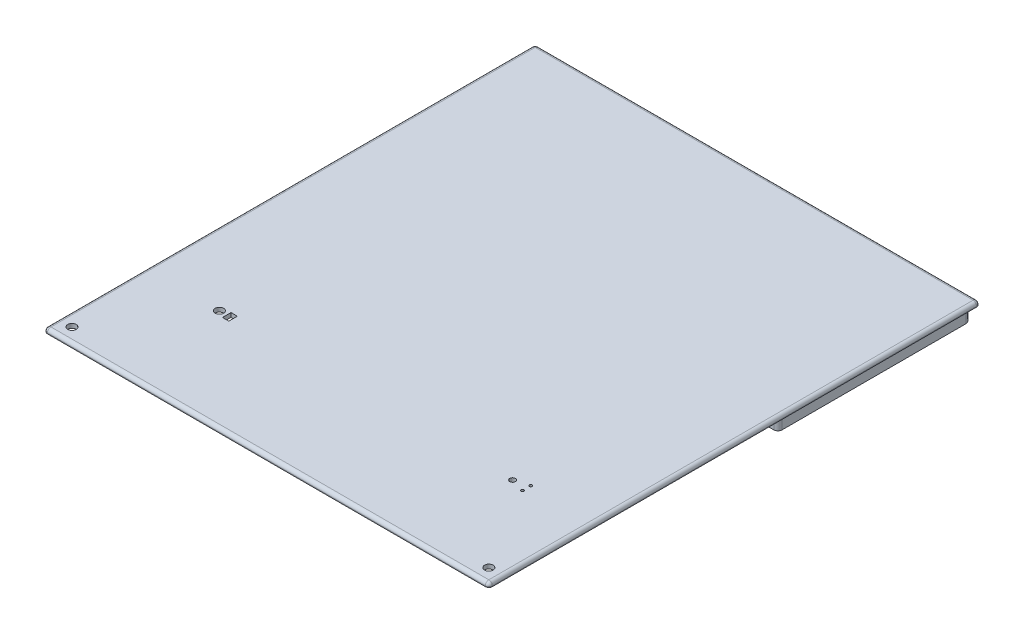
from build123d import *

# Parameters (mm, degrees)
BOSS_EXTRUDE1_DEPTH      = 1.25
SKETCH1_W                = 156
SKETCH1_H                = 69.5
BOSS_EXTRUDE2_DEPTH      = 105
SKETCH4_R                = 2.5000000000000027
BOSS_EXTRUDE3_DEPTH      = 8
FILLET2_R                = 2
SKETCH5_R                = 1.5499999999999998
SKETCH5_R_2              = 1.5500000000000012
CUT_EXTRUDE1_DEPTH       = 8
SKETCH6_R                = 8.25
CUT_EXTRUDE2_DEPTH       = 8
SKETCH8_R                = 3.750000000000007
SKETCH8_R_2              = 3.0000000000000084
SKETCH8_W                = 7.000000000000014
SKETCH8_H                = 14
CUT_EXTRUDE3_DEPTH       = 8
FILLET3_R                = 1.25
FILLET4_R                = 1.25
SKETCH11_R               = 1.5499999999999932
CUT_EXTRUDE4_DEPTH       = 8
BOSS_EXTRUDE5_REACH      = 209.004
FILLET5_R                = 1.25
SKETCH14_R               = 1.5249999999999995
CUT_EXTRUDE5_DEPTH       = 8
BOSS_EXTRUDE6_DEPTH      = 5
CUT_EXTRUDE10_DEPTH      = 176.50000000000017
CUT_EXTRUDE10_DEPTH_BACK = 9
SKETCH19_R               = 1.5249999999999995
BOSS_EXTRUDE7_DEPTH      = 1.5
SKETCH17_W               = 214.39373035957487
SKETCH17_H               = 311.75060194691184
CUT_EXTRUDE6_DEPTH       = 142.50000000000003
SKETCH18_W               = 843.8612520819788
SKETCH18_H               = 210.19069540658822
CUT_EXTRUDE7_DEPTH       = 211.50000000000009
FILLET6_R                = 1.25
SKETCH21_R               = 1.5249999999999995
CUT_EXTRUDE11_DEPTH      = 46.50000000000004
SKETCH22_R               = 1.5249999999999952
SKETCH22_R_2             = 0.49999999999999917
SKETCH22_R_3             = 0.9999999999999983
CUT_EXTRUDE12_DEPTH      = 46.50000000000004
SKETCH23_W               = 224.34927592813784
SKETCH23_H               = 20
CUT_EXTRUDE13_DEPTH      = 108.00000000000004
SKETCH24_W               = 223.8278832276348
SKETCH24_H               = 83.20006380200533
CUT_EXTRUDE14_DEPTH      = 108.00000000000004
BOSS_EXTRUDE8_DEPTH      = 79.12
FILLET7_R                = 1.25
SKETCH27_R               = 1.5249999999999904
SKETCH27_R_2             = 0.9999999999999983
SKETCH27_R_3             = 0.4999999999999892
SKETCH27_R_4             = 0.5000000000000013
SKETCH27_W               = 2.251539255366019
SKETCH27_H               = 3.049999999999997
CUT_EXTRUDE16_DEPTH      = 79.12
SKETCH28_R               = 1.5249999999999995
CUT_EXTRUDE17_DEPTH      = 79.12


with BuildPart() as part:
    # Sketch2 → Boss-Extrude1 (new body)
    with BuildSketch(Plane(origin=(0, 0, 0), x_dir=(1, 0, 0), z_dir=(0, 1, 0))):
        Polygon((-79.25000000000004, 35.99999999999998), (79.24999999999996, 35.99999999999999), (79.24999999999999, -159.00000000000003), (-79.25000000000001, -159.00000000000003), align=None)
    extrude(amount=-BOSS_EXTRUDE1_DEPTH)

    # Sketch1 → Boss-Extrude2 (add)
    with BuildSketch(Plane(origin=(0, 0, 0), x_dir=(1, 0, 0), z_dir=(0, 1, 0))):
        Polygon((79.24999999999999, -159.00000000000003), (-79.25000000000001, -159.00000000000003), (-79.25000000000004, -86.00000000000001), (-79.25000000000004, -36.00000000000002), (-79.25000000000004, 35.99999999999998), (79.24999999999996, 35.99999999999999), (79.24999999999996, -36.00000000000002), (79.24999999999996, -86.00000000000001), align=None)
        Polygon((-78.00000000000001, -157.75000000000006), (77.99999999999999, -157.75000000000006), (77.99999999999996, -86.00000000000001), (77.99999999999996, -36.00000000000002), (-78.00000000000004, -36.00000000000002), (-78.00000000000004, -86.00000000000001), (-78.00000000000004, -100.58859756900745), align=None, mode=Mode.SUBTRACT)
        Rectangle(SKETCH1_W, SKETCH1_H, mode=Mode.SUBTRACT)
    extrude(amount=BOSS_EXTRUDE2_DEPTH)

    # Sketch4 → Boss-Extrude3 (add)
    with BuildSketch(Plane(origin=(0, 0, 0), x_dir=(1, 0, 0), z_dir=(0, 1, 0))):
        with Locations(Location((-37.074999999999996, -117.75000000000004, 0), (0, 0, 90))):
            Circle(SKETCH4_R)
        with Locations(Location((37.074999999999996, -117.75000000000003, 0), (0, 0, 90))):
            Circle(SKETCH4_R)
    extrude(amount=BOSS_EXTRUDE3_DEPTH)

    # Fillet2
    fillet2_edges = [part.edges().sort_by_distance(p)[0] for p in [
        (77.99999999999996, 52.5, -34.749999999999986),
        (77.99999999999996, 52.5, 34.750000000000014),
        (-78.00000000000004, 0, 1.421e-14),
        (-78.00000000000004, 52.5, 34.750000000000014),
        (77.99999999999999, 52.5, 157.75000000000006),
        (-78.00000000000001, 52.5, 157.75000000000006),
        (-4.263e-14, 0, 36.00000000000002),
        (-78.00000000000004, 52.5, 36.00000000000002),
        (77.99999999999997, 0, 96.87500000000003),
        (77.99999999999996, 52.5, 36.00000000000002),
        (-4.263e-14, 0, -34.749999999999986),
        (-78.00000000000004, 52.5, -34.749999999999986),
        (-1.421e-14, 0, 157.75000000000006),
        (-78.00000000000003, 0, 96.87500000000004),
        (77.99999999999996, 0, 1.421e-14),
        (-4.263e-14, 0, 34.750000000000014),
        (-37.074999999999996, 0, 120.25000000000004),
        (37.074999999999996, 0, 120.25000000000003),
    ]]
    fillet(fillet2_edges, radius=FILLET2_R)

    # Sketch5 → Cut-Extrude1 (cut)
    with BuildSketch(Plane.XY.offset(36.00000000000002)):
        with BuildLine():
            ThreePointArc((-53.750000000000085, 99.54999999999998), (-54.84601551083924, 99.09601551083914), (-55.30000000000008, 97.99999999999999))
            Line((-55.30000000000008, 97.99999999999999), (-53.750000000000085, 97.99999999999999))
            Line((-53.750000000000085, 97.99999999999999), (-53.750000000000085, 99.54999999999998))
        make_face()
        with BuildLine():
            Line((-53.750000000000085, 97.99999999999999), (-55.30000000000008, 97.99999999999999))
            ThreePointArc((-55.30000000000008, 97.99999999999999), (-53.750000000000085, 96.44999999999999), (-52.20000000000009, 97.99999999999999))
            ThreePointArc((-52.20000000000009, 97.99999999999999), (-52.65398448916093, 99.09601551083914), (-53.750000000000085, 99.54999999999998))
            Line((-53.750000000000085, 99.54999999999998), (-53.750000000000085, 97.99999999999999))
        make_face()
        with Locations((53.750000000000206, 97.99999999999967)):
            Circle(SKETCH5_R)
        with Locations((-53.750000000000085, 7.999999999999743)):
            Circle(SKETCH5_R_2)
        with Locations((53.749999999999666, 7.9999999999994245)):
            Circle(SKETCH5_R_2)
    extrude(amount=-CUT_EXTRUDE1_DEPTH, mode=Mode.SUBTRACT)

    # Sketch6 → Cut-Extrude2 (cut)
    with BuildSketch(Plane(origin=(0, 0, 157.75000000000006), x_dir=(-1, 0, 0), z_dir=(0, 0, -1))):
        with Locations((0, 22)):
            Circle(SKETCH6_R)
    extrude(amount=-CUT_EXTRUDE2_DEPTH, mode=Mode.SUBTRACT)

    # Sketch8 → Cut-Extrude3 (cut)
    with BuildSketch(Plane.ZY.offset(79.25000000000004)):
        with Locations((131.5, 54.99999999999998)):
            Circle(SKETCH8_R)
        with Locations((101.50000000000001, 54.99999999999998)):
            Circle(SKETCH8_R_2)
        with Locations((116.50000000000003, 64.99999999999999)):
            Rectangle(SKETCH8_W, SKETCH8_H)
        with Locations((101.50000000000001, 64.99999999999997)):
            Circle(SKETCH8_R_2)
        with Locations((101.50000000000001, 74.99999999999997)):
            Circle(SKETCH8_R_2)
        with Locations((101.50000000000001, 84.99999999999997)):
            Circle(SKETCH8_R_2)
        with Locations((131.5, 74.99999999999999)):
            Circle(SKETCH8_R)
    extrude(amount=-CUT_EXTRUDE3_DEPTH, mode=Mode.SUBTRACT)

    # Fillet3
    fillet3_edges = [part.edges().sort_by_distance(p)[0] for p in [
        (79.24999999999997, -1.25, 61.50000000000002),
        (-4.263e-14, -1.25, -35.999999999999986),
        (-79.25000000000003, -1.25, 61.50000000000003),
        (-1.421e-14, -1.25, 159.00000000000003),
    ]]
    fillet(fillet3_edges, radius=FILLET3_R)

    # Fillet4
    # the kernel refuses this fillet: 1.25 mm, written as the material it takes off along each edge
    with BuildSketch(Plane(origin=(-78.00000000000004, 0, -34.74999999999997), x_dir=(-9e-17, 0, -1), z_dir=(-1, 0, 1.5e-16))) as fillet4_piece_1_section:
        Polygon((0, 0), (FILLET4_R, 0), (FILLET4_R, FILLET4_R), (0, FILLET4_R), align=None)
    fillet4_piece_1 = extrude(amount=FILLET4_R, mode=Mode.PRIVATE)
    fillet4_piece_1 = fillet4_piece_1 - Plane(origin=(-78.00000000000004, 0, -34.74999999999997), x_dir=(0, 0.7071067811865475, 0.7071067811865475), z_dir=(-1, 0, 1.5e-16)) * Sphere(FILLET4_R, mode=Mode.PRIVATE)
    add(fillet4_piece_1, mode=Mode.SUBTRACT)
    with BuildSketch(Plane(origin=(77.99999999999996, 0, -34.74999999999999), x_dir=(-9e-17, 0, -1), z_dir=(1, 0, -1.5e-16))) as fillet4_piece_2_section:
        Polygon((0, 0), (FILLET4_R, 0), (FILLET4_R, -FILLET4_R), (0, -FILLET4_R), align=None)
    fillet4_piece_2 = extrude(amount=FILLET4_R, mode=Mode.PRIVATE)
    fillet4_piece_2 = fillet4_piece_2 - Plane(origin=(77.99999999999996, 0, -34.74999999999999), x_dir=(0, 0.7071067811865475, 0.7071067811865475), z_dir=(1, 0, -1.5e-16)) * Sphere(FILLET4_R, mode=Mode.PRIVATE)
    add(fillet4_piece_2, mode=Mode.SUBTRACT)
    with BuildSketch(Plane(origin=(-78.00000000000001, 0, 157.75000000000003), x_dir=(-1, 0, 1.5e-16), z_dir=(0, 0, 1))) as fillet4_piece_3_section:
        Polygon((0, 0), (FILLET4_R, 0), (FILLET4_R, FILLET4_R), (0, FILLET4_R), align=None)
    fillet4_piece_3 = extrude(amount=FILLET4_R, mode=Mode.PRIVATE)
    fillet4_piece_3 = fillet4_piece_3 - Plane(origin=(-78.00000000000001, 0, 157.75000000000003), x_dir=(0.7071067811865475, 0.7071067811865475, 0), z_dir=(0, 0, 1)) * Sphere(FILLET4_R, mode=Mode.PRIVATE)
    add(fillet4_piece_3, mode=Mode.SUBTRACT)
    with BuildSketch(Plane(origin=(77.99999999999999, 0, 157.75000000000003), x_dir=(1, 0, -1.5e-16), z_dir=(0, 0, 1))) as fillet4_piece_4_section:
        Polygon((0, 0), (FILLET4_R, 0), (FILLET4_R, -FILLET4_R), (0, -FILLET4_R), align=None)
    fillet4_piece_4 = extrude(amount=FILLET4_R, mode=Mode.PRIVATE)
    fillet4_piece_4 = fillet4_piece_4 - Plane(origin=(77.99999999999999, 0, 157.75000000000003), x_dir=(-0.7071067811865475, 0.7071067811865475, 0), z_dir=(0, 0, 1)) * Sphere(FILLET4_R, mode=Mode.PRIVATE)
    add(fillet4_piece_4, mode=Mode.SUBTRACT)
    with BuildSketch(Plane(origin=(79.24999999999999, 108.12500000000007, 159.00000000000003), x_dir=(-1, 0, 0), z_dir=(0, -1, 0))) as fillet4_piece_5:
        with BuildLine():
            CenterArc((FILLET4_R, FILLET4_R), FILLET4_R, 179.9999999999987, 90.00000000000131)
            Line((0, FILLET4_R), (0, 0))
            Line((0, 0), (FILLET4_R, 0))
        make_face()
    extrude(amount=108.12500000000007, mode=Mode.SUBTRACT)
    with BuildSketch(Plane(origin=(-79.25000000000001, -2.2e-16, 159.00000000000003), x_dir=(1, 0, 0), z_dir=(0, 1, 0))) as fillet4_piece_6:
        with BuildLine():
            CenterArc((FILLET4_R, FILLET4_R), FILLET4_R, 180, 90)
            Line((0, FILLET4_R), (0, 0))
            Line((0, 0), (FILLET4_R, 0))
        make_face()
    extrude(amount=108.12499999999999, mode=Mode.SUBTRACT)
    with BuildSketch(Plane(origin=(79.24999999999996, 108.125, -35.99999999999999), x_dir=(0, 0, 1), z_dir=(0, -1, 0))) as fillet4_piece_7:
        with BuildLine():
            CenterArc((FILLET4_R, FILLET4_R), FILLET4_R, 180, 90)
            Line((0, FILLET4_R), (0, 0))
            Line((0, 0), (FILLET4_R, 0))
        make_face()
    extrude(amount=108.125, mode=Mode.SUBTRACT)
    with BuildSketch(Plane(origin=(-79.25000000000004, -2.2e-16, -35.99999999999998), x_dir=(0, 0, 1), z_dir=(0, 1, 0))) as fillet4_piece_8:
        with BuildLine():
            CenterArc((FILLET4_R, FILLET4_R), FILLET4_R, 180, 90)
            Line((-2.132e-14, FILLET4_R), (0, 0))
            Line((0, 0), (FILLET4_R, 0))
        make_face()
    extrude(amount=108.12499999999999, mode=Mode.SUBTRACT)

    # Sketch11 → Cut-Extrude4 (cut)
    with BuildSketch(Plane(origin=(79.24999999999996, 0, -1.128e-14), x_dir=(-1.4e-16, 0, -1), z_dir=(1, 0, -1.4e-16))):
        with BuildLine():
            ThreePointArc((-13.05000000000001, 102.49999999999999), (-12.596015510839159, 101.40398448916083), (-11.50000000000001, 100.94999999999999))
            Line((-11.50000000000001, 100.94999999999999), (-11.50000000000001, 102.49999999999999))
            Line((-11.500000000000014, 102.49999999999999), (-13.050000000000011, 102.49999999999999))
        make_face()
        with BuildLine():
            Line((-11.50000000000001, 102.49999999999999), (-11.50000000000001, 100.94999999999999))
            ThreePointArc((-11.50000000000001, 100.94999999999999), (-10.403984489160864, 101.40398448916083), (-9.950000000000012, 102.49999999999999))
            ThreePointArc((-9.950000000000012, 102.49999999999999), (-11.50000000000001, 104.04999999999998), (-13.05000000000001, 102.49999999999999))
            Line((-13.050000000000011, 102.49999999999999), (-11.500000000000014, 102.49999999999999))
        make_face()
        with BuildLine():
            ThreePointArc((-25.550000000000008, 90), (-25.096015510839155, 88.90398448916085), (-24.000000000000007, 88.45))
            Line((-24.000000000000007, 88.45000000000002), (-24.000000000000007, 90))
            Line((-24, 90), (-25.55000000000001, 90))
        make_face()
        with BuildLine():
            Line((-24.000000000000007, 90), (-24.000000000000007, 88.45000000000002))
            ThreePointArc((-24.000000000000007, 88.45), (-22.90398448916086, 88.90398448916085), (-22.450000000000006, 90))
            ThreePointArc((-22.450000000000006, 90), (-24.000000000000007, 91.55), (-25.550000000000008, 90))
            Line((-25.55000000000001, 90), (-24, 90))
        make_face()
        with BuildLine():
            ThreePointArc((-9.949999999999998, 2.4999999999999742), (-10.403984489160848, 3.5960155108391216), (-11.499999999999995, 4.049999999999974))
            Line((-11.499999999999996, 4.049999999999969), (-11.499999999999996, 2.4999999999999716))
            Line((-11.5, 2.4999999999999742), (-13.049999999999997, 2.4999999999999742))
            ThreePointArc((-13.049999999999995, 2.4999999999999742), (-11.499999999999996, 0.9499999999999749), (-9.949999999999998, 2.499999999999974))
        make_face()
        with BuildLine():
            Line((-11.499999999999996, 2.4999999999999716), (-11.499999999999996, 4.049999999999969))
            ThreePointArc((-11.499999999999995, 4.049999999999974), (-12.596015510839145, 3.596015510839123), (-13.049999999999995, 2.4999999999999742))
            Line((-13.049999999999997, 2.4999999999999742), (-11.5, 2.4999999999999742))
        make_face()
        with BuildLine():
            ThreePointArc((-111.5, 4.049999999999969), (-112.59601551083915, 1.40398448916083), (-109.95, 2.499999999999974))
            Line((-109.95, 2.4999999999999742), (-111.5, 2.4999999999999742))
            Line((-111.5, 2.4999999999999716), (-111.5, 4.049999999999969))
        make_face()
        with BuildLine():
            Line((-111.5, 2.4999999999999742), (-109.95, 2.4999999999999742))
            ThreePointArc((-109.95, 2.4999999999999742), (-110.40398448916086, 3.5960155108391185), (-111.5, 4.049999999999969))
            Line((-111.5, 4.049999999999969), (-111.5, 2.4999999999999716))
        make_face()
        with BuildLine():
            ThreePointArc((-97.45, 14.999999999999993), (-97.90398448916086, 16.096015510839138), (-99, 16.549999999999986))
            Line((-99, 16.549999999999986), (-99, 14.999999999999993))
            Line((-99, 14.999999999999993), (-97.45, 14.999999999999993))
        make_face()
        with BuildLine():
            Line((-99, 14.999999999999993), (-99, 16.549999999999986))
            ThreePointArc((-99, 16.549999999999986), (-100.09601551083915, 13.903984489160848), (-97.45, 14.999999999999993))
            Line((-97.45, 14.999999999999993), (-99, 14.999999999999993))
        make_face()
        with BuildLine():
            ThreePointArc((-22.450000000000006, 14.999999999999993), (-22.90398448916086, 16.09601551083914), (-24.000000000000007, 16.549999999999994))
            Line((-24.000000000000007, 16.549999999999994), (-24.000000000000007, 14.999999999999993))
            Line((-24, 14.999999999999993), (-25.55000000000001, 14.999999999999993))
            ThreePointArc((-25.550000000000008, 14.999999999999993), (-24.000000000000007, 13.449999999999992), (-22.450000000000006, 14.999999999999993))
        make_face()
        with BuildLine():
            Line((-24.000000000000007, 14.999999999999993), (-24.000000000000007, 16.549999999999994))
            ThreePointArc((-24.000000000000007, 16.549999999999994), (-25.096015510839155, 16.09601551083914), (-25.550000000000008, 14.999999999999993))
            Line((-25.55000000000001, 14.999999999999993), (-24, 14.999999999999993))
        make_face()
        with Locations((-111.50000000000001, 102.49999999999999)):
            Circle(SKETCH11_R)
        with Locations((-99, 90)):
            Circle(SKETCH11_R)
    extrude(amount=-CUT_EXTRUDE4_DEPTH, mode=Mode.SUBTRACT)

    # Boss-Extrude5: up to this face of the body (flat: up to its plane)
    boss_extrude5_end = Plane(part.part.faces().sort_by_distance((0, 0, 96.725539908))[0])
    # Sketch12 → Boss-Extrude5 (add, up to the picked face)
    with BuildSketch(Plane(origin=(0, 105, 0), x_dir=(1, 0, 0), z_dir=(0, 1, 0)), mode=Mode.PRIVATE) as boss_extrude5_sk1:
        with BuildLine():
            Line((73, -152.75000000000043), (72.99999999999997, -157.75000000000043))
            Line((72.99999999999997, -157.75000000000043), (75.99999999999996, -157.75000000000045))
            ThreePointArc((75.99999999999996, -157.75000000000006), (77.41421356237305, -157.16421356237316), (77.99999999999994, -155.75000000000006))
            Line((77.99999999999999, -155.75000000000006), (78, -152.75000000000045))
            Line((78, -152.75000000000045), (73, -152.75000000000043))
        make_face()
    boss_extrude5_tool1 = split(extrude(boss_extrude5_sk1.sketch, amount=-BOSS_EXTRUDE5_REACH, mode=Mode.PRIVATE), bisect_by=boss_extrude5_end, keep=Keep.BOTH, mode=Mode.PRIVATE)
    # Sketch12 → Boss-Extrude5 (add, up to the picked face)
    with BuildSketch(Plane(origin=(0, 105, 0), x_dir=(1, 0, 0), z_dir=(0, 1, 0)), mode=Mode.PRIVATE) as boss_extrude5_sk2:
        with BuildLine():
            ThreePointArc((-78.00000000000003, -155.75000000000006), (-77.41421356237313, -157.16421356237316), (-76.00000000000003, -157.75000000000006))
            Line((-76.00000000000003, -157.75000000000006), (-73.00000000000003, -157.75000000000006))
            Line((-73.00000000000003, -157.75000000000006), (-73.00000000000003, -152.75000000000006))
            Line((-73.00000000000003, -152.75000000000006), (-78.00000000000003, -152.75000000000006))
            Line((-78.00000000000003, -152.75000000000006), (-78.00000000000003, -155.75000000000006))
        make_face()
    boss_extrude5_tool2 = split(extrude(boss_extrude5_sk2.sketch, amount=-BOSS_EXTRUDE5_REACH, mode=Mode.PRIVATE), bisect_by=boss_extrude5_end, keep=Keep.BOTH, mode=Mode.PRIVATE)
    add(boss_extrude5_tool1.solids().sort_by(Axis((75.426992, 105, 155.176992), (0, -1, 0)))[0])
    add(boss_extrude5_tool2.solids().sort_by(Axis((-75.426992, 105, 155.176992), (0, -1, 0)))[0])

    # Fillet5
    fillet5_edges = [part.edges().sort_by_distance(p)[0] for p in [
        (77.41421356237306, 0.5857864376269042, 152.75000000000043),
        (72.99999999999999, 0.5857864376269046, 157.16421356237316),
        (72.99999999999997, 53.5, 157.75000000000043),
        (74.49999999999999, 0, 152.75000000000043),
        (73, 52.5, 152.75000000000043),
        (78, 53.5, 152.75000000000045),
        (73, 0, 154.25000000000023),
        (-77.41421356237313, 0.5857864376269042, 152.75000000000006),
        (-73.00000000000003, 0, 154.25000000000006),
        (-73.00000000000003, 52.5, 152.75000000000006),
        (-78.00000000000003, 53.5, 152.75000000000006),
        (-74.50000000000003, 0, 152.75000000000006),
        (-73.00000000000003, 0.5857864376269046, 157.16421356237316),
        (-73.00000000000003, 53.5, 157.75000000000006),
    ]]
    fillet(fillet5_edges, radius=FILLET5_R)

    # Sketch14 → Cut-Extrude5 (cut)
    with BuildSketch(Plane(origin=(0, 105, 0), x_dir=(1, 0, 0), z_dir=(0, 1, 0))):
        with Locations(Location((75.68305826175839, -155.43305826175865, 0), (0, 0, 270))):
            Circle(SKETCH14_R)
        with Locations(Location((-75.68305826175845, -155.43305826175828, 0), (0, 0, 270))):
            Circle(SKETCH14_R)
    extrude(amount=-CUT_EXTRUDE5_DEPTH, mode=Mode.SUBTRACT)

    # Sketch19 → Cut-Extrude10 (cut, two sides: drawn at the far end of the back side and taken through both)
    with BuildSketch(Plane(origin=(0, 105, 0), x_dir=(1, 0, 0), z_dir=(0, 1, 0)).offset(-CUT_EXTRUDE10_DEPTH_BACK)):
        with Locations(Location((75.68305826175839, -155.43305826175865, 0), (0, 0, 270))):
            Circle(SKETCH19_R)
        with Locations(Location((-75.68305826175845, -155.43305826175828, 0), (0, 0, 270))):
            Circle(SKETCH19_R)
    extrude(amount=CUT_EXTRUDE10_DEPTH + CUT_EXTRUDE10_DEPTH_BACK, mode=Mode.SUBTRACT)



with BuildPart() as body_2:
    # Sketch15 → Boss-Extrude6 (new body)
    with BuildSketch(Plane(origin=(0, 105, 0), x_dir=(1, 0, 0), z_dir=(0, 1, 0))):
        with BuildLine():
            Line((-77.50000000000004, 32.749999999999986), (-77.50000000000004, -32.750000000000014))
            ThreePointArc((-77.50000000000004, -32.750000000000014), (-77.06066017177986, -33.81066017177984), (-76.00000000000004, -34.250000000000014))
            Line((-76.00000000000004, -34.250000000000014), (75.99999999999996, -34.250000000000014))
            ThreePointArc((75.99999999999996, -34.250000000000014), (77.06066017177977, -33.81066017177984), (77.49999999999996, -32.750000000000014))
            Line((77.49999999999996, -32.750000000000014), (77.49999999999996, 32.749999999999986))
            ThreePointArc((77.49999999999996, 32.749999999999986), (77.06066017177977, 33.81066017177981), (75.99999999999996, 34.249999999999986))
            Line((75.99999999999996, 34.249999999999986), (-76.00000000000004, 34.249999999999986))
            ThreePointArc((-76.00000000000004, 34.249999999999986), (-77.06066017177986, 33.81066017177981), (-77.50000000000004, 32.749999999999986))
        make_face()
        with BuildLine():
            Line((75.99999999999996, 32.999999999999986), (-76.00000000000004, 32.999999999999986))
            ThreePointArc((-76.00000000000004, 32.999999999999986), (-76.17677669529668, 32.926776695296624), (-76.25000000000004, 32.749999999999986))
            Line((-76.25000000000004, 32.749999999999986), (-76.25000000000004, -32.750000000000014))
            ThreePointArc((-76.25000000000004, -32.750000000000014), (-76.17677669529668, -32.92677669529665), (-76.00000000000004, -33.000000000000014))
            Line((-76.00000000000004, -33.000000000000014), (75.99999999999996, -33.000000000000014))
            ThreePointArc((75.99999999999996, -33.000000000000014), (76.1767766952966, -32.92677669529665), (76.24999999999996, -32.750000000000014))
            Line((76.24999999999996, -32.750000000000014), (76.24999999999996, 32.749999999999986))
            ThreePointArc((76.24999999999996, 32.749999999999986), (76.1767766952966, 32.926776695296624), (75.99999999999996, 32.999999999999986))
        make_face(mode=Mode.SUBTRACT)
    extrude(amount=-BOSS_EXTRUDE6_DEPTH)


with BuildPart() as part_1:
    add(part.part)

    add(body_2.part)  # Boss-Extrude7 merges body 2
    # Sketch16 → Boss-Extrude7 (add)
    with BuildSketch(Plane(origin=(0, 105, 0), x_dir=(1, 0, 0), z_dir=(0, 1, 0))):
        with BuildLine():
            Line((-79.25000000000004, 34.74999999999998), (-79.25000000000004, -157.75000000000003))
            ThreePointArc((-79.25000000000004, -157.75000000000003), (-78.88388347648322, -158.63388347648322), (-78.00000000000001, -159.00000000000003))
            Line((-78.00000000000001, -159.00000000000003), (77.99999999999999, -159.00000000000003))
            ThreePointArc((77.99999999999999, -159.00000000000003), (78.88388347648316, -158.63388347648322), (79.24999999999999, -157.75000000000003))
            Line((79.24999999999999, -157.75000000000003), (79.24999999999991, 34.749999999999986))
            ThreePointArc((79.24999999999991, 34.749999999999986), (78.8838834764831, 35.63388347648314), (77.99999999999996, 35.99999999999997))
            Line((77.99999999999996, 35.99999999999997), (-78.00000000000004, 35.99999999999998))
            ThreePointArc((-78.00000000000004, 35.99999999999998), (-78.88388347648322, 35.63388347648316), (-79.25000000000004, 34.74999999999998))
        make_face()
    extrude(amount=BOSS_EXTRUDE7_DEPTH)

    # Sketch17 → Cut-Extrude6 (cut)
    with BuildSketch(Plane.XZ.offset(-105)):
        with Locations((-9.695908791144348, 54.3605461890202)):
            Rectangle(SKETCH17_W, SKETCH17_H)
        with BuildLine():
            Line((77.99999999999996, -32.749999999999986), (77.99999999999996, 32.750000000000014))
            ThreePointArc((77.99999999999996, 32.750000000000014), (77.41421356237305, 34.16421356237311), (75.99999999999996, 34.750000000000014))
            Line((75.99999999999996, 34.750000000000014), (-76.00000000000004, 34.750000000000014))
            ThreePointArc((-76.00000000000004, 34.750000000000014), (-77.41421356237313, 34.16421356237311), (-78.00000000000004, 32.750000000000014))
            Line((-78.00000000000004, 32.750000000000014), (-78.00000000000004, -32.749999999999986))
            ThreePointArc((-78.00000000000004, -32.749999999999986), (-77.41421356237313, -34.16421356237308), (-76.00000000000004, -34.749999999999986))
            Line((-76.00000000000004, -34.749999999999986), (75.99999999999996, -34.749999999999986))
            ThreePointArc((75.99999999999996, -34.749999999999986), (77.41421356237305, -34.16421356237308), (77.99999999999996, -32.749999999999986))
        make_face(mode=Mode.SUBTRACT)
    extrude(amount=CUT_EXTRUDE6_DEPTH, mode=Mode.SUBTRACT)


with BuildPart() as cut_extrude6_piece_1:
    # of the separate pieces the step leaves, piece 1, a body of its own (cut_extrude6_pieces)
    add(part_1.part.solids().sort_by_distance((-76, 105, -34.25))[0])

    # Fillet6
    fillet6_edges = [cut_extrude6_piece_1.edges().sort_by_distance(p)[0] for p in [
        (-78.88388347648322, 106.5, -35.633883476483156),
        (-79.25000000000004, 106.5, 61.50000000000002),
        (-78.88388347648322, 106.5, 158.63388347648322),
        (-1.421e-14, 106.5, 159.00000000000003),
        (78.88388347648318, 106.5, 158.63388347648322),
        (79.24999999999994, 106.5, 61.50000000000003),
        (78.8838834764831, 106.5, -35.63388347648314),
        (-4.263e-14, 106.5, -35.99999999999997),
    ]]
    fillet(fillet6_edges, radius=FILLET6_R)

    # Sketch21 → Cut-Extrude11 (cut)
    with BuildSketch(Plane(origin=(0, 106.5, 0), x_dir=(1, 0, 0), z_dir=(0, 1, 0))):
        with Locations(Location((-75.68068975770814, -155.43068975770817, 0), (0, 0, 270))):
            Circle(SKETCH21_R)
        with Locations(Location((75.68068975770811, -155.43068975770834, 0), (0, 0, 270))):
            Circle(SKETCH21_R)
    extrude(amount=-CUT_EXTRUDE11_DEPTH, mode=Mode.SUBTRACT)

    # Sketch22 → Cut-Extrude12 (cut)
    with BuildSketch(Plane(origin=(0, 106.5, 0), x_dir=(1, 0, 0), z_dir=(0, 1, 0))):
        with Locations(Location((-53.000000000000014, -122.75000000000003, 0), (0, 0, 270))):
            Circle(SKETCH22_R)
        with Locations(Location((53.000000000000014, -121.25000000000003, 0), (0, 0, 270))):
            Circle(SKETCH22_R_2)
        with Locations(Location((53.000000000000014, -124.25000000000003, 0), (0, 0, 270))):
            Circle(SKETCH22_R_2)
        with Locations(Location((48.000000000000014, -122.75000000000003, 0), (0, 0, 270))):
            Circle(SKETCH22_R_3)
    extrude(amount=-CUT_EXTRUDE12_DEPTH, mode=Mode.SUBTRACT)

    # Sketch23 → Cut-Extrude13 (cut)
    with BuildSketch(Plane.XZ.offset(-105)):
        with Locations((5.748765940339929, 69.87855319631414)):
            Rectangle(SKETCH23_W, SKETCH23_H)
    extrude(amount=-CUT_EXTRUDE13_DEPTH, mode=Mode.SUBTRACT)


with BuildPart() as cut_extrude6_piece_2:
    # of the separate pieces the step leaves, piece 2, a body of its own (cut_extrude6_pieces)
    add(part_1.part.solids().sort_by_distance((-78, 2, -32.75))[0])

    # Sketch18 → Cut-Extrude7 (cut)
    with BuildSketch(Plane.XZ.offset(-99.99999999999999)):
        Rectangle(SKETCH18_W, SKETCH18_H)
    extrude(amount=CUT_EXTRUDE7_DEPTH, mode=Mode.SUBTRACT)


with BuildPart() as cut_extrude13_piece_1:
    # of the separate pieces the step leaves, piece 1, a body of its own (cut_extrude13_pieces)
    add(cut_extrude6_piece_1.part.solids().sort_by_distance((-79.25, 105, 59.878553196))[0])

    # Sketch25 → Boss-Extrude8 (add)
    with BuildSketch(Plane.XY.offset(59.87855319631415)):
        with BuildLine():
            Line((79.24999999999999, 105), (79.24999999999997, 105.25))
            ThreePointArc((79.24999999999997, 105.25), (78.88388347648316, 106.13388347648318), (77.99999999999999, 106.5))
            Line((77.99999999999999, 106.5), (-78.00000000000003, 106.5))
            ThreePointArc((-78.00000000000003, 106.5), (-78.8838834764832, 106.13388347648319), (-79.25000000000003, 105.25))
            Line((-79.25000000000003, 105.25), (-79.25000000000003, 105))
            Line((-79.25000000000003, 105), (79.24999999999999, 105))
        make_face()
    extrude(amount=BOSS_EXTRUDE8_DEPTH)

    # Fillet7
    fillet7_edges = [cut_extrude13_piece_1.edges().sort_by_distance(p)[0] for p in [
        (79.24999999999997, 105.125, 138.99855319631416),
        (78.88388347648316, 106.13388347648318, 138.99855319631416),
        (-1.421e-14, 106.5, 138.99855319631416),
        (-78.8838834764832, 106.13388347648319, 138.99855319631416),
        (-79.25000000000003, 105.125, 138.99855319631416),
    ]]
    fillet(fillet7_edges, radius=FILLET7_R)

    # Sketch27 → Cut-Extrude16 (cut)
    with BuildSketch(Plane(origin=(0, 106.5, 0), x_dir=(1, 0, 0), z_dir=(0, 1, 0))):
        with Locations(Location((-53.00000000000005, -102.74855319631415, 0), (0, 0, 270))):
            Circle(SKETCH27_R)
        with Locations(Location((51.437037476114, -102.74855319631415, 0), (0, 0, 270))):
            Circle(SKETCH27_R_2)
        with Locations(Location((56.43703747611401, -101.24855319631415, 0), (0, 0, 270))):
            Circle(SKETCH27_R_3)
        with Locations(Location((56.437037476114, -104.24855319631413, 0), (0, 0, 270))):
            Circle(SKETCH27_R_4)
        with Locations((-49.25000000000004, -102.74855319631416)):
            Rectangle(SKETCH27_W, SKETCH27_H)
    extrude(amount=-CUT_EXTRUDE16_DEPTH, mode=Mode.SUBTRACT)

    # Sketch28 → Cut-Extrude17 (cut)
    with BuildSketch(Plane(origin=(0, 106.5, 0), x_dir=(1, 0, 0), z_dir=(0, 1, 0))):
        with BuildLine():
            ThreePointArc((-72.72500000000001, -133.99855319631416), (-74.25000000000001, -132.47355319631416), (-75.77500000000002, -133.99855319631416))
            Line((-75.77500000000002, -133.99855319631416), (-74.25000000000001, -133.99855319631416))
            Line((-74.25000000000001, -133.99855319631416), (-74.25000000000001, -135.52355319631417))
            ThreePointArc((-74.25, -135.52355319631417), (-73.17166215869052, -135.07689103762365), (-72.72500000000001, -133.99855319631416))
        make_face()
        with BuildLine():
            Line((-74.25000000000001, -133.99855319631416), (-75.77500000000002, -133.99855319631416))
            ThreePointArc((-75.77500000000002, -133.99855319631416), (-75.32833784130949, -135.07689103762365), (-74.25, -135.52355319631417))
            Line((-74.25000000000001, -135.52355319631417), (-74.25000000000001, -133.99855319631416))
        make_face()
        with Locations(Location((74.25000000000001, -133.99855319631462, 0), (0, 0, 270))):
            Circle(SKETCH28_R)
    extrude(amount=-CUT_EXTRUDE17_DEPTH, mode=Mode.SUBTRACT)


with BuildPart() as cut_extrude13_piece_2:
    # of the separate pieces the step leaves, piece 2, a body of its own (cut_extrude13_pieces)
    add(cut_extrude6_piece_1.part.solids().sort_by_distance((-78, 105.25, 159))[0])

    # Sketch24 → Cut-Extrude14 (cut)
    with BuildSketch(Plane(origin=(0, 0, 79.87855319631414), x_dir=(-1, 0, 0), z_dir=(0, 0, -1))):
        with Locations((-6.53504656057757, 105)):
            Rectangle(SKETCH24_W, SKETCH24_H)
    extrude(amount=-CUT_EXTRUDE14_DEPTH, mode=Mode.SUBTRACT)


solid = cut_extrude13_piece_1.part
